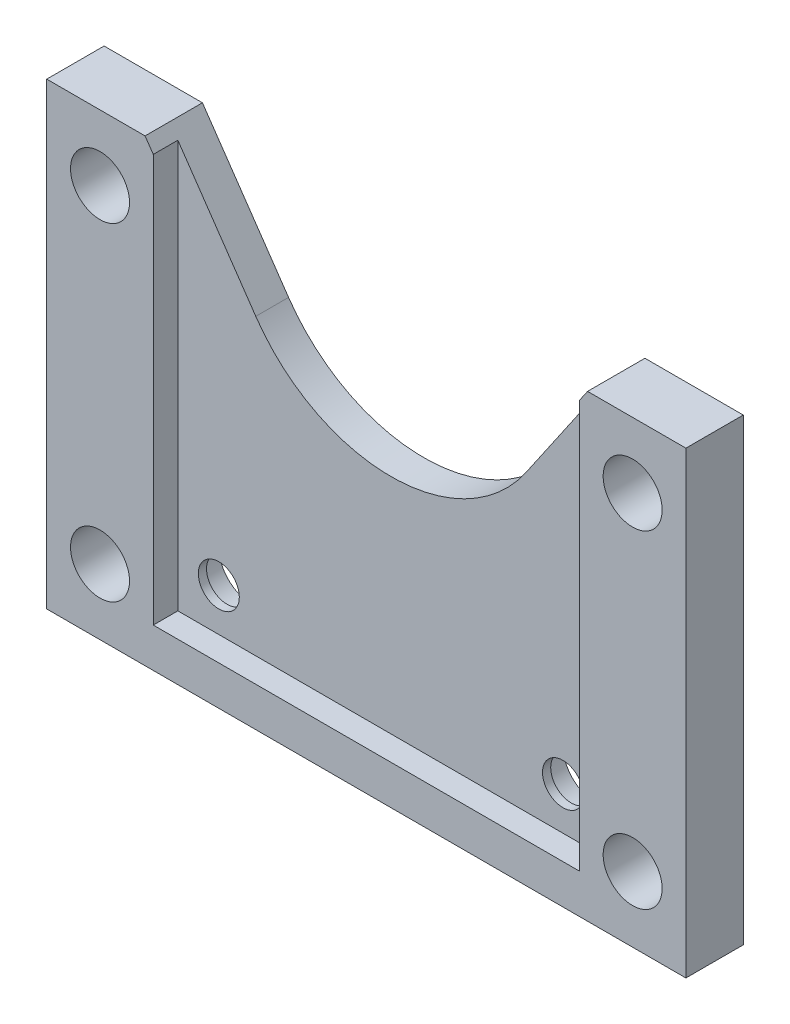
from build123d import *

# Parameters (mm, degrees)
SKETCH_1_R          = 1.25
SKETCH_1_R_2        = 1.8
EXTRUDE_1_DEPTH     = 2
SKETCH_3_R          = 1.8
EXTRUDE_2_DEPTH     = 1.5
SKETCH_4_R          = 2
CUT_EXTRUDE_1_DEPTH = 1.5


with BuildPart() as part:
    # ｽｹｯﾁ1 → ﾎﾞｽ - 押し出し1 (new body)
    with BuildSketch(Plane.XY):
        with BuildLine():
            Line((19.5, -5), (-19.5, -5))
            Line((-19.5, -5), (-19.5, 23))
            Line((-19.5, 23), (-13.5, 23))
            Line((-13.5, 23), (-8.245593322, 15.342245077))
            ThreePointArc((-8.245593322, 15.342245077), (0, 11), (8.245593322, 15.342245077))
            Line((8.245593322, 15.342245077), (13.5, 23))
            Line((13.5, 23), (19.5, 23))
            Line((19.5, 23), (19.5, -5))
        make_face()
        with Locations((-10.5, 0)):
            Circle(SKETCH_1_R, mode=Mode.SUBTRACT)
        with Locations((10.5, 0)):
            Circle(SKETCH_1_R, mode=Mode.SUBTRACT)
        with Locations((-16.25, -1)):
            Circle(SKETCH_1_R_2, mode=Mode.SUBTRACT)
        with Locations((-16.25, 19)):
            Circle(SKETCH_1_R_2, mode=Mode.SUBTRACT)
        with Locations((16.25, -1)):
            Circle(SKETCH_1_R_2, mode=Mode.SUBTRACT)
        with Locations((16.25, 19)):
            Circle(SKETCH_1_R_2, mode=Mode.SUBTRACT)
    extrude(amount=EXTRUDE_1_DEPTH)

    # ｽｹｯﾁ3 → ﾎﾞｽ - 押し出し2 (add)
    with BuildSketch(Plane.XY.offset(2)):
        Polygon((-13, 22.271301653), (-13, -2.6), (13, -2.6), (13, 22.271301653), (13.5, 23), (19.5, 23), (19.5, -5), (-19.5, -5), (-19.5, 23), (-13.5, 23), align=None)
        with Locations((-16.25, 19)):
            Circle(SKETCH_3_R, mode=Mode.SUBTRACT)
        with Locations((-16.25, -1)):
            Circle(SKETCH_3_R, mode=Mode.SUBTRACT)
        with Locations((16.25, -1)):
            Circle(SKETCH_3_R, mode=Mode.SUBTRACT)
        with Locations((16.25, 19)):
            Circle(SKETCH_3_R, mode=Mode.SUBTRACT)
    extrude(amount=EXTRUDE_2_DEPTH)

    # ｽｹｯﾁ4 → ｶｯﾄ - 押し出し1 (cut)
    with BuildSketch(Plane(origin=(0, 0, 0), x_dir=(-1, 0, 0), z_dir=(0, 0, -1))):
        with Locations((-10.5, 0)):
            Circle(SKETCH_4_R)
        with Locations((10.5, 0)):
            Circle(SKETCH_4_R)
    extrude(amount=-CUT_EXTRUDE_1_DEPTH, mode=Mode.SUBTRACT)


solid = part.part
